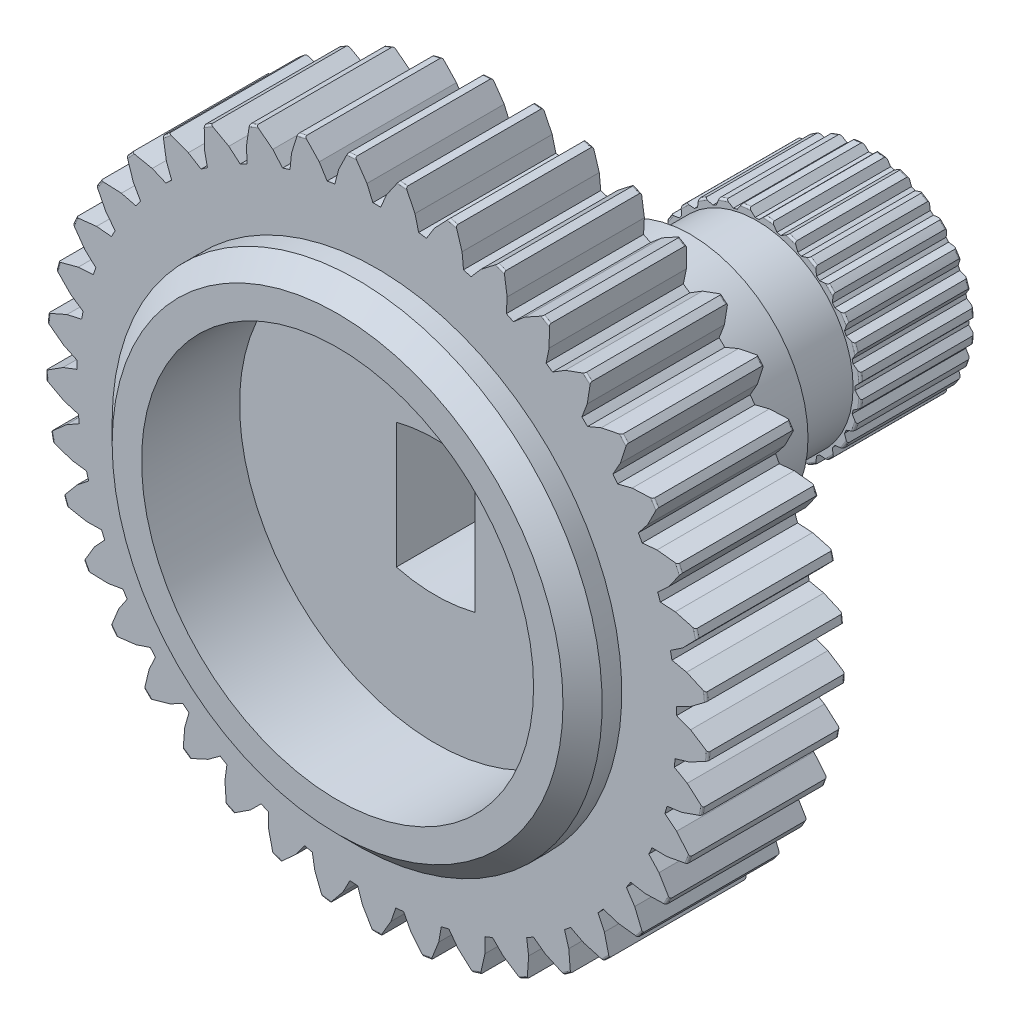
from build123d import *

# Parameters (mm, degrees)
CROQUIS1_R              = 8.45
SALIENTE_EXTRUIR1_DEPTH = 3.5
REDONDEO1_R             = 0.05
CROQUIS2_R              = 6.25
SALIENTE_EXTRUIR2_DEPTH = 1
CHAFL_N1_SIZE           = 0.5
CORTAR_EXTRUIR1_DEPTH   = 3.8
MATRIZC1_COUNT          = 41
CROQUIS3_3_R            = 3.5
SALIENTE_EXTRUIR3_DEPTH = 1.8
CROQUIS5_R              = 3
SALIENTE_EXTRUIR4_DEPTH = 2.7
CROQUIS6_R              = 2.65
SALIENTE_EXTRUIR5_DEPTH = 4.6
CROQUIS8_OUTSIDE_W      = 24.39
CROQUIS8_OUTSIDE_H      = 24.378
CROQUIS8_OUTSIDE_R      = 2.45
CORTAR_EXTRUIR3_DEPTH   = 1.7
REDONDEO4_R             = 0.05
CORTAR_EXTRUIR2_DEPTH   = 2.9
MATRIZC2_COUNT          = 28
CROQUIS9_R              = 0.7
CORTAR_EXTRUIR4_DEPTH   = 1
CROQUIS10_R             = 1.5
CORTAR_EXTRUIR5_DEPTH   = 4
CHAFL_N2_SIZE           = 0.3
CROQUIS11_R             = 5
CORTAR_EXTRUIR6_DEPTH   = 2.5
CORTAR_EXTRUIR7_DEPTH   = 3


with BuildPart() as part:
    # Croquis1 → Saliente-Extruir1 (new body)
    with BuildSketch(Plane.XY):
        Circle(CROQUIS1_R)
    extrude(amount=SALIENTE_EXTRUIR1_DEPTH)

    # Redondeo1
    redondeo1_edges = [part.edges().sort_by_distance(p)[0] for p in [
        (-8.45, 0, 0),
        (-8.45, 0, 3.5),
    ]]
    fillet(redondeo1_edges, radius=REDONDEO1_R)

    # Croquis2 → Saliente-Extruir2 (add)
    with BuildSketch(Plane.XY.offset(3.5)):
        Circle(CROQUIS2_R)
    extrude(amount=SALIENTE_EXTRUIR2_DEPTH)

    # Chaflán1
    chafl_n1_edges = [part.edges().sort_by_distance(p)[0] for p in [
        (-6.25, 0, 4.5),
    ]]
    chamfer(chafl_n1_edges, length=CHAFL_N1_SIZE)

    # Croquis3 → Cortar-Extruir1 (cut)
    with BuildSketch(Plane(origin=(0, 0, 0), x_dir=(-1, 0, 0), z_dir=(0, 0, -1))):
        with BuildLine():
            ThreePointArc((-0.1, 7.649346377), (0, 7.65), (0.1, 7.649346377))
            Line((0.1, 7.649346377), (0.25, 8))
            Line((0.25, 8), (0.55, 8.432081594))
            Line((0.55, 8.432081594), (0.55, 8.6))
            Line((0.55, 8.6), (-0.55, 8.6))
            Line((-0.55, 8.6), (-0.55, 8.432081594))
            Line((-0.55, 8.432081594), (-0.25, 8))
            Line((-0.25, 8), (-0.1, 7.649346377))
        make_face()
    cortar_extruir1 = extrude(amount=-CORTAR_EXTRUIR1_DEPTH, mode=Mode.SUBTRACT)

    # MatrizC1: Cortar-Extruir1 ×41 about axis
    matrizc1_axis = Axis((0, 0, 3.5), (0, 0, -1))
    for i in range(1, MATRIZC1_COUNT):
        add(cortar_extruir1.rotate(matrizc1_axis, i * 360 / MATRIZC1_COUNT), mode=Mode.SUBTRACT)

    # Croquis3<3> → Saliente-Extruir3 (add)
    with BuildSketch(Plane(origin=(0, 0, 0), x_dir=(-1, 0, 0), z_dir=(0, 0, -1))):
        Circle(CROQUIS3_3_R)
    extrude(amount=SALIENTE_EXTRUIR3_DEPTH)

    # Croquis5 → Saliente-Extruir4 (add)
    with BuildSketch(Plane(origin=(0, 0, -1.8), x_dir=(-1, 0, 0), z_dir=(0, 0, -1))):
        Circle(CROQUIS5_R)
    extrude(amount=SALIENTE_EXTRUIR4_DEPTH)

    # Croquis6 → Saliente-Extruir5 (add)
    with BuildSketch(Plane(origin=(0, 0, -4.5), x_dir=(-1, 0, 0), z_dir=(0, 0, -1))):
        Circle(CROQUIS6_R)
    extrude(amount=SALIENTE_EXTRUIR5_DEPTH)

    # Croquis8 outside → Cortar-Extruir3 (cut)
    with BuildSketch(Plane(origin=(0, 0, -4.5), x_dir=(-1, 0, 0), z_dir=(0, 0, -1))):
        with Locations((0, -0.009)):
            Rectangle(CROQUIS8_OUTSIDE_W, CROQUIS8_OUTSIDE_H)
        Circle(CROQUIS8_OUTSIDE_R, mode=Mode.SUBTRACT)
    extrude(amount=CORTAR_EXTRUIR3_DEPTH, mode=Mode.SUBTRACT)

    # Redondeo4
    redondeo4_edges = [part.edges().sort_by_distance(p)[0] for p in [
        (2.65, 0, -9.1),
        (2.65, 0, -6.2),
    ]]
    fillet(redondeo4_edges, radius=REDONDEO4_R)

    # Croquis7 → Cortar-Extruir2 (cut)
    with BuildSketch(Plane(origin=(0, 0, -9.1), x_dir=(-1, 0, 0), z_dir=(0, 0, -1))):
        with BuildLine():
            ThreePointArc((-0.05, 2.49949995), (0, 2.5), (0.05, 2.49949995))
            Line((0.05, 2.49949995), (0.2, 2.642442052))
            Line((0.2, 2.642442052), (0.2, 2.7))
            Line((0.2, 2.7), (-0.2, 2.7))
            Line((-0.2, 2.7), (-0.2, 2.642442052))
            Line((-0.2, 2.642442052), (-0.05, 2.49949995))
        make_face()
    cortar_extruir2 = extrude(amount=-CORTAR_EXTRUIR2_DEPTH, mode=Mode.SUBTRACT)

    # MatrizC2: Cortar-Extruir2 ×28 about axis
    matrizc2_axis = Axis((0, 0, -9.1), (0, 0, 1))
    for i in range(1, MATRIZC2_COUNT):
        add(cortar_extruir2.rotate(matrizc2_axis, i * 360 / MATRIZC2_COUNT), mode=Mode.SUBTRACT)

    # Croquis9 → Cortar-Extruir4 (cut)
    with BuildSketch(Plane(origin=(0, 0, 0), x_dir=(-1, 0, 0), z_dir=(0, 0, -1))):
        with Locations((0, 6.3)):
            Circle(CROQUIS9_R)
    extrude(amount=-CORTAR_EXTRUIR4_DEPTH, mode=Mode.SUBTRACT)

    # Croquis10 → Cortar-Extruir5 (cut)
    with BuildSketch(Plane(origin=(0, 0, -9.1), x_dir=(-1, 0, 0), z_dir=(0, 0, -1))):
        Circle(CROQUIS10_R)
    extrude(amount=-CORTAR_EXTRUIR5_DEPTH, mode=Mode.SUBTRACT)

    # Chaflán2
    chafl_n2_edges = [part.edges().sort_by_distance(p)[0] for p in [
        (1.5, 0, -9.1),
    ]]
    chamfer(chafl_n2_edges, length=CHAFL_N2_SIZE)

    # Croquis11 → Cortar-Extruir6 (cut)
    with BuildSketch(Plane.XY.offset(4.5)):
        Circle(CROQUIS11_R)
    extrude(amount=-CORTAR_EXTRUIR6_DEPTH, mode=Mode.SUBTRACT)

    # Croquis12 → Cortar-Extruir7 (cut)
    with BuildSketch(Plane.XY.offset(2)):
        with BuildLine():
            Line((1, 1.6), (1, -1.6))
            ThreePointArc((1, -1.6), (0, -1.727016654), (-1, -1.6))
            Line((-1, -1.6), (-1, 1.6))
            ThreePointArc((-1, 1.6), (0, 1.727016654), (1, 1.6))
        make_face()
    extrude(amount=-CORTAR_EXTRUIR7_DEPTH, mode=Mode.SUBTRACT)


solid = part.part
